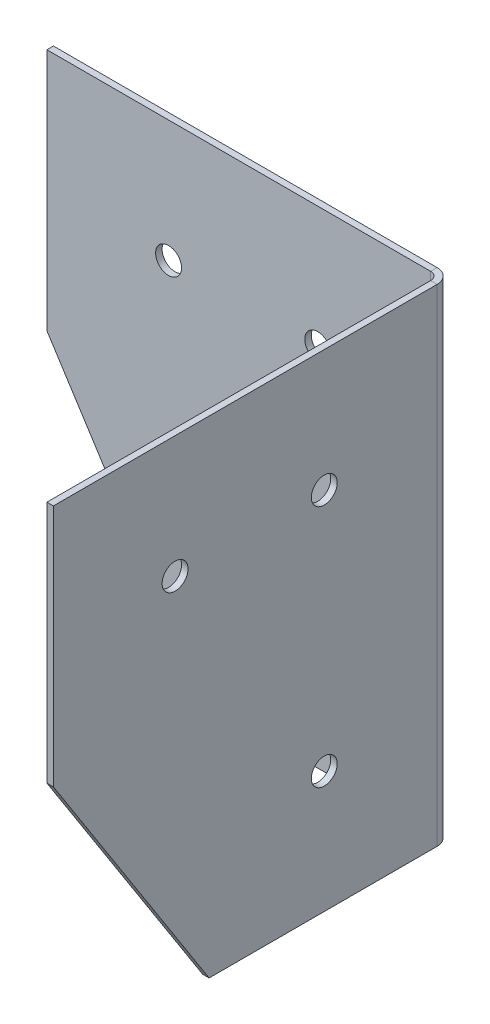
from build123d import *

# Parameters (mm, degrees)
SKETCH3_R                  = 1.6
BASE_FLANGE1_DEPTH         = 0.8
SKETCHED_START             = 0.510326571
SKETCHED_BEND1_OUTLINE_W   = 60
SKETCHED_BEND1_OUTLINE_H   = 0.8
SKETCHED_BEND1_DEPTH       = 47.889673429
SKETCHED_START_2           = -1.099557429
SKETCHED_BEND1_2_OUTLINE_R = 1.6
SKETCHED_BEND1_2_DEPTH     = 1.8
SKETCHED_START_3           = -28.5
SKETCHED_BEND1_3_DEPTH     = 60


with BuildPart() as part:
    # Base-Flange1: sheet metal written as solids
    # Sketch3 → Base-Flange1 (new body)
    with BuildSketch(Plane.XY):
        Polygon((29.2, -28.5), (-29.2, -28.5), (-48.4, 1.5), (-48.4, 31.5), (48.4, 31.5), (48.4, 1.5), align=None)
        with Locations((-33.4, 16.5)):
            Circle(SKETCH3_R, mode=Mode.SUBTRACT)
        with Locations((-15.009973435, 16.5)):
            Circle(SKETCH3_R, mode=Mode.SUBTRACT)
        with Locations((-15.009973435, -13.5)):
            Circle(SKETCH3_R, mode=Mode.SUBTRACT)
        with Locations(Location((15.009973435, -13.5, 0), (0, 0, 180))):
            Circle(SKETCH3_R, mode=Mode.SUBTRACT)
        with Locations(Location((15.009973435, 16.5, 0), (0, 0, 180))):
            Circle(SKETCH3_R, mode=Mode.SUBTRACT)
        with Locations(Location((33.4, 16.5, 0), (0, 0, 180))):
            Circle(SKETCH3_R, mode=Mode.SUBTRACT)
    extrude(amount=-BASE_FLANGE1_DEPTH)

    # Sketched Bend1: read off the stored shape, not the designer's step
    # Sketched Bend1 outline → Sketched Bend1 (cut)
    with BuildSketch(Plane.YZ.offset(SKETCHED_START)):
        with Locations((1.5, -0.4)):
            Rectangle(SKETCHED_BEND1_OUTLINE_W, SKETCHED_BEND1_OUTLINE_H)
    extrude(amount=SKETCHED_BEND1_DEPTH, mode=Mode.SUBTRACT)

    # Sketched Bend1 2 outline → Sketched Bend1 2 (add)
    with BuildSketch(Plane.YZ.offset(SKETCHED_START_2)):
        Polygon((31.5, 0), (31.5, 48.300442571), (1.5, 48.300442571), (-28.5, 29.100442571), (-28.5, 0), align=None)
        with Locations((-13.5, 14.910416006)):
            Circle(SKETCHED_BEND1_2_OUTLINE_R, mode=Mode.SUBTRACT)
        with Locations((16.5, 14.910416006)):
            Circle(SKETCHED_BEND1_2_OUTLINE_R, mode=Mode.SUBTRACT)
        with Locations((16.5, 33.300442571)):
            Circle(SKETCHED_BEND1_2_OUTLINE_R, mode=Mode.SUBTRACT)
    extrude(amount=SKETCHED_BEND1_2_DEPTH)

    # Sketched Bend1 3 outline → Sketched Bend1 3 (cut)
    with BuildSketch(Plane(origin=(0, 0, 0), x_dir=(1, 0, 0), z_dir=(0, 1, 0)).offset(SKETCHED_START_3)):
        with BuildLine():
            Line((-1.099557429, -48.300442571), (-0.099557429, -48.300442571))
            Line((-0.099557429, -48.300442571), (-0.099557429, -1))
            ThreePointArc((-0.099557429, -1), (-0.392450648, -0.292893219), (-1.099557429, 0))
            Line((-1.099557429, 0), (-1.099557429, -48.300442571))
        make_face()
        with BuildLine():
            ThreePointArc((-1.099557429, 0.8), (0.173234777, 0.272792206), (0.700442571, -1))
            Line((0.700442571, -1), (0.700442571, 0))
            Line((0.700442571, 0), (0.510326571, 0))
            Line((0.510326571, 0), (0.510326571, 0.8))
            Line((0.510326571, 0.8), (-1.099557429, 0.8))
        make_face()
    extrude(amount=SKETCHED_BEND1_3_DEPTH, mode=Mode.SUBTRACT)


solid = part.part
